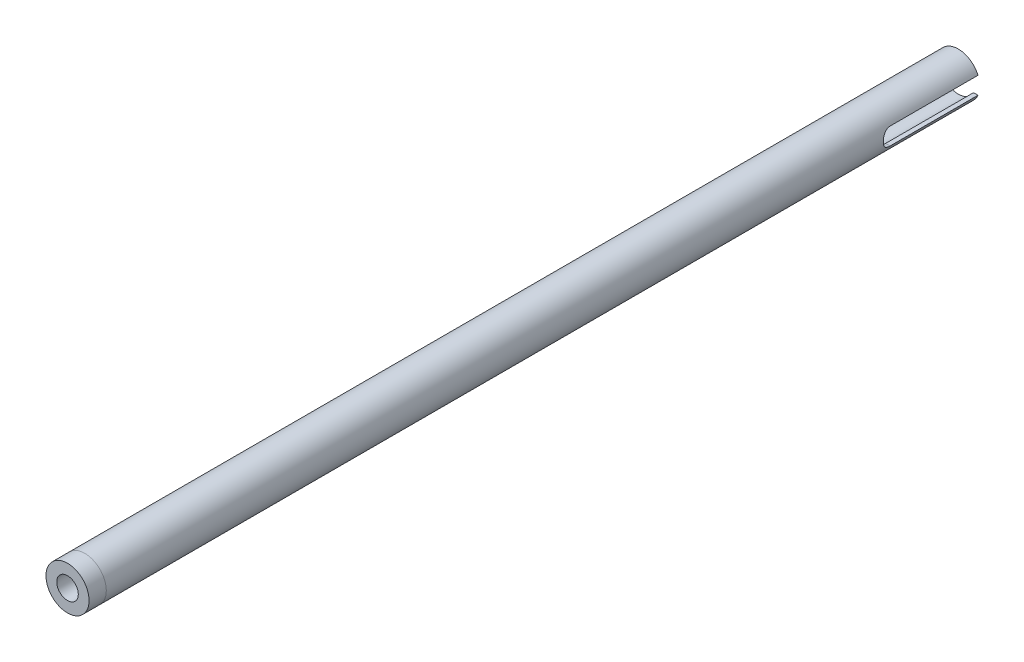
from build123d import *

# Parameters (mm, degrees)
THREADED_INSERT_1_1_DEPTH = 6.35
THREADED_START            = -6.35
THREADED_INSERT_1_2_DEPTH = 9.525
A_ARM_START               = -6.35
A_ARM_TUBE_DEPTH          = 321.72025
APEX_START                = -292.51025
APEX_SLOT_DEPTH           = 35.56
FILLET1_R                 = 3.175


with BuildPart() as part:
    # Sketch1 → Threaded insert 1-1 (new body)
    with BuildSketch(Plane.XY):
        with BuildLine():
            ThreePointArc((-2.38125, 3.175), (0, 3.96875), (2.38125, 3.175))
            Line((2.38125, 3.175), (5.630856905, 3.175))
            ThreePointArc((5.630856905, 3.175), (0, 6.4643), (-5.630856905, 3.175))
            Line((-5.630856905, 3.175), (-2.38125, 3.175))
        make_face()
        with BuildLine():
            ThreePointArc((-5.630856905, 3.175), (0, 6.4643), (5.630856905, 3.175))
            Line((5.630856905, 3.175), (7.274838916, 3.175))
            ThreePointArc((7.274838916, 3.175), (0, 7.9375), (-7.274838916, 3.175))
            Line((-7.274838916, 3.175), (-5.630856905, 3.175))
        make_face()
        with BuildLine():
            ThreePointArc((2.38125, 3.175), (3.549757914, 1.774878957), (3.96875, 0))
            Line((3.96875, 0), (6.4643, 0))
            ThreePointArc((6.4643, 0), (6.252468424, 1.641283978), (5.630856905, 3.175))
            Line((5.630856905, 3.175), (2.38125, 3.175))
        make_face()
        with BuildLine():
            Line((-6.4643, 0), (-3.96875, 0))
            ThreePointArc((-3.96875, 0), (-3.549757914, 1.774878957), (-2.38125, 3.175))
            Line((-2.38125, 3.175), (-5.630856905, 3.175))
            ThreePointArc((-5.630856905, 3.175), (-6.252468424, 1.641283978), (-6.4643, 0))
        make_face()
        with BuildLine():
            ThreePointArc((5.630856905, 3.175), (6.252468424, 1.641283978), (6.4643, 0))
            Line((6.4643, 0), (7.9375, 0))
            ThreePointArc((7.9375, 0), (7.770068859, 1.621707797), (7.274838916, 3.175))
            Line((7.274838916, 3.175), (5.630856905, 3.175))
        make_face()
        with BuildLine():
            Line((-7.9375, 0), (-6.4643, 0))
            ThreePointArc((-6.4643, 0), (-6.252468424, 1.641283978), (-5.630856905, 3.175))
            Line((-5.630856905, 3.175), (-7.274838916, 3.175))
            ThreePointArc((-7.274838916, 3.175), (-7.770068859, 1.621707797), (-7.9375, 0))
        make_face()
        with BuildLine():
            Line((7.9375, 0), (6.4643, 0))
            ThreePointArc((6.4643, 0), (6.252468424, -1.641283978), (5.630856905, -3.175))
            Line((5.630856905, -3.175), (7.274838916, -3.175))
            ThreePointArc((7.274838916, -3.175), (7.770068859, -1.621707797), (7.9375, 0))
        make_face()
        with BuildLine():
            ThreePointArc((-5.630856905, -3.175), (-6.252468424, -1.641283978), (-6.4643, 0))
            Line((-6.4643, 0), (-7.9375, 0))
            ThreePointArc((-7.9375, 0), (-7.770068859, -1.621707797), (-7.274838916, -3.175))
            Line((-7.274838916, -3.175), (-5.630856905, -3.175))
        make_face()
        with BuildLine():
            Line((6.4643, 0), (3.96875, 0))
            ThreePointArc((3.96875, 0), (3.549757914, -1.774878957), (2.38125, -3.175))
            Line((2.38125, -3.175), (5.630856905, -3.175))
            ThreePointArc((5.630856905, -3.175), (6.252468424, -1.641283978), (6.4643, 0))
        make_face()
        with BuildLine():
            ThreePointArc((-2.38125, -3.175), (-3.549757914, -1.774878957), (-3.96875, 0))
            Line((-3.96875, 0), (-6.4643, 0))
            ThreePointArc((-6.4643, 0), (-6.252468424, -1.641283978), (-5.630856905, -3.175))
            Line((-5.630856905, -3.175), (-2.38125, -3.175))
        make_face()
        with BuildLine():
            Line((5.630856905, -3.175), (2.38125, -3.175))
            ThreePointArc((2.38125, -3.175), (0, -3.96875), (-2.38125, -3.175))
            Line((-2.38125, -3.175), (-5.630856905, -3.175))
            ThreePointArc((-5.630856905, -3.175), (0, -6.4643), (5.630856905, -3.175))
        make_face()
        with BuildLine():
            Line((7.274838916, -3.175), (5.630856905, -3.175))
            ThreePointArc((5.630856905, -3.175), (0, -6.4643), (-5.630856905, -3.175))
            Line((-5.630856905, -3.175), (-7.274838916, -3.175))
            ThreePointArc((-7.274838916, -3.175), (0, -7.9375), (7.274838916, -3.175))
        make_face()
    extrude(amount=-THREADED_INSERT_1_1_DEPTH)

    # Sketch1<3> → Threaded insert 1-2 (add)
    with BuildSketch(Plane.XY.offset(THREADED_START)):
        with BuildLine():
            ThreePointArc((-2.38125, 3.175), (0, 3.96875), (2.38125, 3.175))
            Line((2.38125, 3.175), (5.630856905, 3.175))
            ThreePointArc((5.630856905, 3.175), (0, 6.4643), (-5.630856905, 3.175))
            Line((-5.630856905, 3.175), (-2.38125, 3.175))
        make_face()
        with BuildLine():
            ThreePointArc((2.38125, 3.175), (3.549757914, 1.774878957), (3.96875, 0))
            Line((3.96875, 0), (6.4643, 0))
            ThreePointArc((6.4643, 0), (6.252468424, 1.641283978), (5.630856905, 3.175))
            Line((5.630856905, 3.175), (2.38125, 3.175))
        make_face()
        with BuildLine():
            Line((-6.4643, 0), (-3.96875, 0))
            ThreePointArc((-3.96875, 0), (-3.549757914, 1.774878957), (-2.38125, 3.175))
            Line((-2.38125, 3.175), (-5.630856905, 3.175))
            ThreePointArc((-5.630856905, 3.175), (-6.252468424, 1.641283978), (-6.4643, 0))
        make_face()
        with BuildLine():
            Line((6.4643, 0), (3.96875, 0))
            ThreePointArc((3.96875, 0), (3.549757914, -1.774878957), (2.38125, -3.175))
            Line((2.38125, -3.175), (5.630856905, -3.175))
            ThreePointArc((5.630856905, -3.175), (6.252468424, -1.641283978), (6.4643, 0))
        make_face()
        with BuildLine():
            ThreePointArc((-2.38125, -3.175), (-3.549757914, -1.774878957), (-3.96875, 0))
            Line((-3.96875, 0), (-6.4643, 0))
            ThreePointArc((-6.4643, 0), (-6.252468424, -1.641283978), (-5.630856905, -3.175))
            Line((-5.630856905, -3.175), (-2.38125, -3.175))
        make_face()
        with BuildLine():
            Line((5.630856905, -3.175), (2.38125, -3.175))
            ThreePointArc((2.38125, -3.175), (0, -3.96875), (-2.38125, -3.175))
            Line((-2.38125, -3.175), (-5.630856905, -3.175))
            ThreePointArc((-5.630856905, -3.175), (0, -6.4643), (5.630856905, -3.175))
        make_face()
    extrude(amount=-THREADED_INSERT_1_2_DEPTH)


with BuildPart() as body_2:
    # Sketch1<4> → A-arm tube (new body)
    with BuildSketch(Plane.XY.offset(A_ARM_START)):
        with BuildLine():
            ThreePointArc((-5.630856905, 3.175), (0, 6.4643), (5.630856905, 3.175))
            Line((5.630856905, 3.175), (7.274838916, 3.175))
            ThreePointArc((7.274838916, 3.175), (0, 7.9375), (-7.274838916, 3.175))
            Line((-7.274838916, 3.175), (-5.630856905, 3.175))
        make_face()
        with BuildLine():
            ThreePointArc((5.630856905, 3.175), (6.252468424, 1.641283978), (6.4643, 0))
            Line((6.4643, 0), (7.9375, 0))
            ThreePointArc((7.9375, 0), (7.770068859, 1.621707797), (7.274838916, 3.175))
            Line((7.274838916, 3.175), (5.630856905, 3.175))
        make_face()
        with BuildLine():
            Line((-7.9375, 0), (-6.4643, 0))
            ThreePointArc((-6.4643, 0), (-6.252468424, 1.641283978), (-5.630856905, 3.175))
            Line((-5.630856905, 3.175), (-7.274838916, 3.175))
            ThreePointArc((-7.274838916, 3.175), (-7.770068859, 1.621707797), (-7.9375, 0))
        make_face()
        with BuildLine():
            Line((7.9375, 0), (6.4643, 0))
            ThreePointArc((6.4643, 0), (6.252468424, -1.641283978), (5.630856905, -3.175))
            Line((5.630856905, -3.175), (7.274838916, -3.175))
            ThreePointArc((7.274838916, -3.175), (7.770068859, -1.621707797), (7.9375, 0))
        make_face()
        with BuildLine():
            ThreePointArc((-5.630856905, -3.175), (-6.252468424, -1.641283978), (-6.4643, 0))
            Line((-6.4643, 0), (-7.9375, 0))
            ThreePointArc((-7.9375, 0), (-7.770068859, -1.621707797), (-7.274838916, -3.175))
            Line((-7.274838916, -3.175), (-5.630856905, -3.175))
        make_face()
        with BuildLine():
            Line((7.274838916, -3.175), (5.630856905, -3.175))
            ThreePointArc((5.630856905, -3.175), (0, -6.4643), (-5.630856905, -3.175))
            Line((-5.630856905, -3.175), (-7.274838916, -3.175))
            ThreePointArc((-7.274838916, -3.175), (0, -7.9375), (7.274838916, -3.175))
        make_face()
    extrude(amount=-A_ARM_TUBE_DEPTH)

    # Sketch1<5> → Apex slot (cut)
    with BuildSketch(Plane.XY.offset(APEX_START)):
        with BuildLine():
            ThreePointArc((5.630856905, 3.175), (6.252468424, 1.641283978), (6.4643, 0))
            Line((6.4643, 0), (7.9375, 0))
            ThreePointArc((7.9375, 0), (7.770068859, 1.621707797), (7.274838916, 3.175))
            Line((7.274838916, 3.175), (5.630856905, 3.175))
        make_face()
        with BuildLine():
            Line((-7.9375, 0), (-6.4643, 0))
            ThreePointArc((-6.4643, 0), (-6.252468424, 1.641283978), (-5.630856905, 3.175))
            Line((-5.630856905, 3.175), (-7.274838916, 3.175))
            ThreePointArc((-7.274838916, 3.175), (-7.770068859, 1.621707797), (-7.9375, 0))
        make_face()
        with BuildLine():
            Line((7.9375, 0), (6.4643, 0))
            ThreePointArc((6.4643, 0), (6.252468424, -1.641283978), (5.630856905, -3.175))
            Line((5.630856905, -3.175), (7.274838916, -3.175))
            ThreePointArc((7.274838916, -3.175), (7.770068859, -1.621707797), (7.9375, 0))
        make_face()
        with BuildLine():
            ThreePointArc((-5.630856905, -3.175), (-6.252468424, -1.641283978), (-6.4643, 0))
            Line((-6.4643, 0), (-7.9375, 0))
            ThreePointArc((-7.9375, 0), (-7.770068859, -1.621707797), (-7.274838916, -3.175))
            Line((-7.274838916, -3.175), (-5.630856905, -3.175))
        make_face()
    extrude(amount=-APEX_SLOT_DEPTH, mode=Mode.SUBTRACT)

    # Fillet1
    # the kernel refuses this fillet: 3.175 mm, written as the material it adds along each edge
    with BuildSketch(Plane(origin=(2.306643095, 3.175, -292.51025), x_dir=(0, 0, -1), z_dir=(-1, 0, 0))) as fillet1_piece_1_section:
        with BuildLine():
            CenterArc((FILLET1_R, FILLET1_R), FILLET1_R, 180, 90)
            Line((0, FILLET1_R), (0, 0))
            Line((0, 0), (FILLET1_R, 0))
        make_face()
    fillet1_piece_1 = extrude(amount=17.51898201, mode=Mode.PRIVATE)
    fillet1_piece_1 = fillet1_piece_1 - Plane(origin=(0, 0, -293.22998262), x_dir=(-0.8710698614669244, 0.49115913555994567, 0), z_dir=(0, 0, 1)) * Cylinder(6.4643, 48, mode=Mode.PRIVATE)
    fillet1_piece_1 = fillet1_piece_1 & Plane(origin=(0, 0, -293.22998262), x_dir=(-1, 0, 0), z_dir=(0, 0, 1)) * Cylinder(7.9375, 48, mode=Mode.PRIVATE)
    add(fillet1_piece_1)
    with BuildSketch(Plane(origin=(-15.212338916, -3.175, -292.51025), x_dir=(0, 0, -1), z_dir=(1, 0, 0))) as fillet1_piece_2_section:
        with BuildLine():
            CenterArc((FILLET1_R, FILLET1_R), FILLET1_R, 180, 90)
            Line((0, FILLET1_R), (0, 0))
            Line((0, 0), (FILLET1_R, 0))
        make_face()
    fillet1_piece_2 = extrude(amount=17.51898201, mode=Mode.PRIVATE)
    fillet1_piece_2 = fillet1_piece_2 - Plane(origin=(0, 0, -293.229982783), x_dir=(-0.8710698614669244, 0.49115913555994567, 0), z_dir=(0, 0, 1)) * Cylinder(6.4643, 48, mode=Mode.PRIVATE)
    fillet1_piece_2 = fillet1_piece_2 & Plane(origin=(0, 0, -293.229982783), x_dir=(-1, 0, 0), z_dir=(0, 0, 1)) * Cylinder(7.9375, 48, mode=Mode.PRIVATE)
    add(fillet1_piece_2)
    with BuildSketch(Plane(origin=(-2.306643095, -3.175, -292.51025), x_dir=(0, 0, -1), z_dir=(1, 0, 0))) as fillet1_piece_3_section:
        with BuildLine():
            CenterArc((FILLET1_R, FILLET1_R), FILLET1_R, 180, 90)
            Line((0, FILLET1_R), (0, 0))
            Line((0, 0), (FILLET1_R, 0))
        make_face()
    fillet1_piece_3 = extrude(amount=17.51898201, mode=Mode.PRIVATE)
    fillet1_piece_3 = fillet1_piece_3 - Plane(origin=(0, 0, -293.22998262), x_dir=(-0.8710698614669244, 0.49115913555994567, 0), z_dir=(0, 0, 1)) * Cylinder(6.4643, 48, mode=Mode.PRIVATE)
    fillet1_piece_3 = fillet1_piece_3 & Plane(origin=(0, 0, -293.22998262), x_dir=(-1, 0, 0), z_dir=(0, 0, 1)) * Cylinder(7.9375, 48, mode=Mode.PRIVATE)
    add(fillet1_piece_3)
    with BuildSketch(Plane(origin=(15.212338916, 3.175, -292.51025), x_dir=(0, -1, 0), z_dir=(-1, 0, 0))) as fillet1_piece_4_section:
        with BuildLine():
            CenterArc((FILLET1_R, -FILLET1_R), FILLET1_R, 90, 90)
            Line((0, -FILLET1_R), (0, 0))
            Line((0, 0), (FILLET1_R, 0))
        make_face()
    fillet1_piece_4 = extrude(amount=17.51898201, mode=Mode.PRIVATE)
    fillet1_piece_4 = fillet1_piece_4 - Plane(origin=(0, 0, -293.229982609), x_dir=(-0.8710698614669244, 0.49115913555994567, 0), z_dir=(0, 0, 1)) * Cylinder(6.4643, 48, mode=Mode.PRIVATE)
    fillet1_piece_4 = fillet1_piece_4 & Plane(origin=(0, 0, -293.229982609), x_dir=(-1, 0, 0), z_dir=(0, 0, 1)) * Cylinder(7.9375, 48, mode=Mode.PRIVATE)
    add(fillet1_piece_4)


solid = Compound([part.part, body_2.part])
